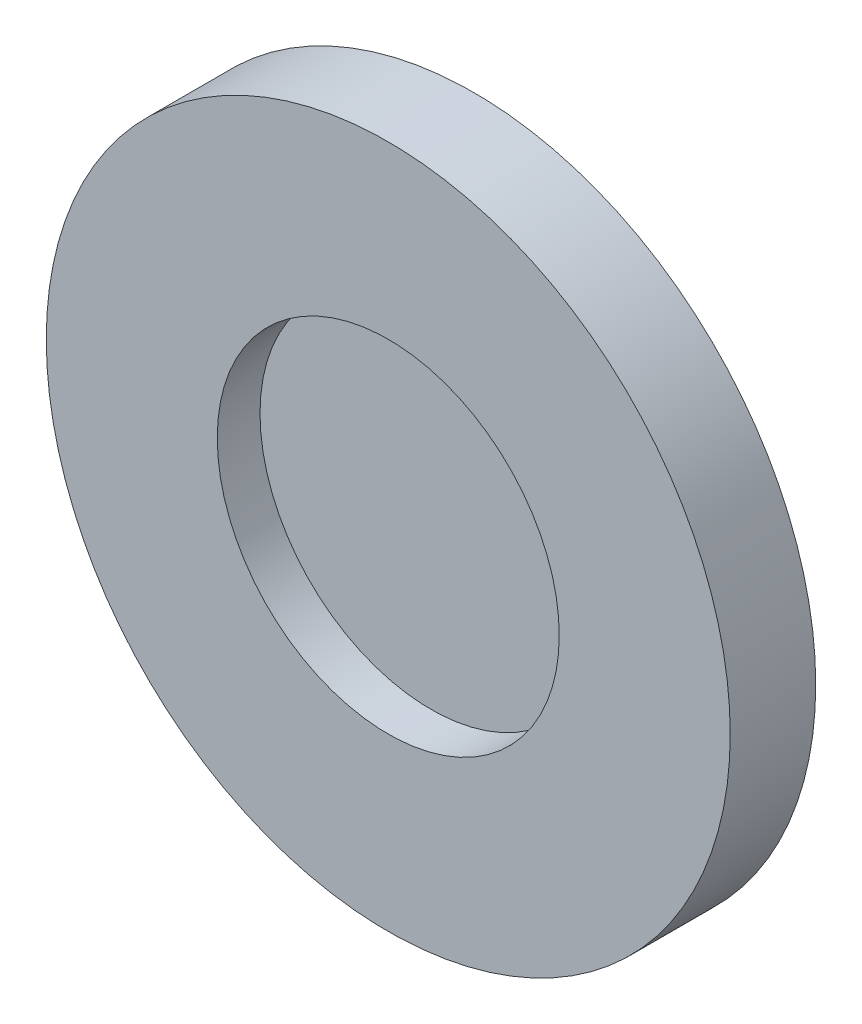
from build123d import *

# Parameters (mm, degrees)
ESBO_O1_R                = 4
RESSALTO_EXTRUS_O1_DEPTH = 1
ESBO_O2_R                = 2
CORTE_EXTRUS_O1_DEPTH    = 0.5


with BuildPart() as part:
    # Esboço1 → Ressalto-extrusão1 (new body)
    with BuildSketch(Plane.XY):
        Circle(ESBO_O1_R)
    extrude(amount=RESSALTO_EXTRUS_O1_DEPTH)

    # Esboço2 → Corte-extrusão1 (cut)
    with BuildSketch(Plane.XY.offset(1)):
        Circle(ESBO_O2_R)
    extrude(amount=-CORTE_EXTRUS_O1_DEPTH, mode=Mode.SUBTRACT)


solid = part.part
